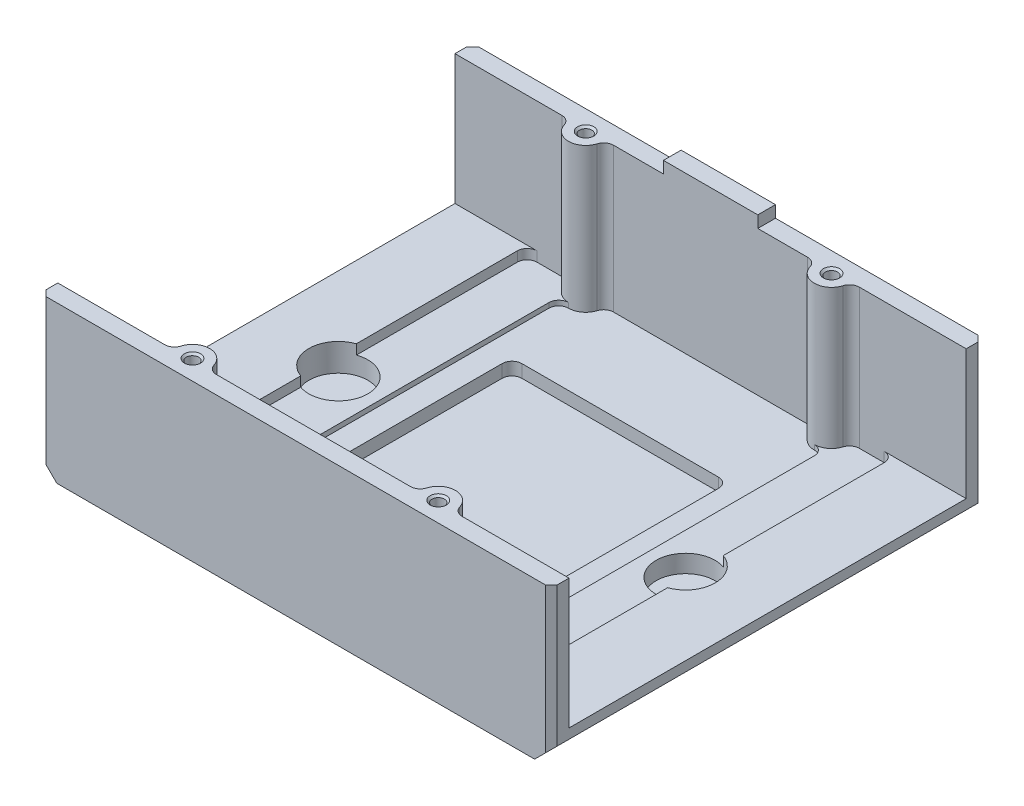
from build123d import *

# Parameters (mm, degrees)
SKETCH_1_W                     = 52
SKETCH_1_H                     = 44
EXTRUDE_1_DEPTH                = 16.5
SHELL_1_T                      = -1.8
CUT_EXTRUDE_1_DEPTH            = 68.500296296
CUT_EXTRUDE_1_DEPTH_BACK       = 68.500296296
SKETCH_3_W                     = 40.4
SKETCH_3_H                     = 14.7
SKETCH_4_W                     = 12.5
SKETCH_4_H                     = 40.4
EXTRUDE_2_DEPTH                = 1.5
CUT_EXTRUDE_2_DEPTH            = 1
EXTRUDE_3_REACH                = 66.438
SKETCH_6_R                     = 1.75
HOLE_WIZARD_M1_6_1_D           = 1.25
HOLE_WIZARD_M1_6_1_DEPTH       = 12
HOLE_WIZARD_M1_6_1_CSINK_D     = 1.65
HOLE_WIZARD_M1_6_1_CSINK_ANGLE = 90
HOLE_WIZARD_M1_6_1_TIP         = 0.375537887
SKETCH_11_W                    = 22
SKETCH_11_H                    = 22
CUT_EXTRUDE_3_DEPTH            = 1.3
CHAMFER_2_SIZE                 = 0.6
FILLET_1_R                     = 1
SKETCH_13_W                    = 9.6
SKETCH_13_H                    = 1.8
EXTRUDE_4_DEPTH                = 1.2
CHAMFER_3_SIZE                 = 2.3
SKETCH_14_R                    = 3
CUT_EXTRUDE_5_DEPTH            = 16


with BuildPart() as part:
    # 스케치1 → 보스-돌출1 (new body)
    with BuildSketch(Plane(origin=(0, 0, 0), x_dir=(1, 0, 0), z_dir=(0, 1, 0))):
        with Locations((20, 20)):
            Rectangle(SKETCH_1_W, SKETCH_1_H)
    extrude(amount=-EXTRUDE_1_DEPTH)

    # 쉘1
    shell_1_openings = [part.faces().sort_by_distance(p)[0] for p in [
        (20, 0, -20),
    ]]
    offset(amount=SHELL_1_T, openings=shell_1_openings, kind=Kind.INTERSECTION)

    # 스케치3 → 컷-돌출1 (cut, two sides: drawn at the far end of the back side and taken through both)
    with BuildSketch(Plane(origin=(-4.2, 0, 0), x_dir=(0, 0, -1), z_dir=(1, 0, 0)).offset(-CUT_EXTRUDE_1_DEPTH_BACK)):
        with Locations((20, -7.35)):
            Rectangle(SKETCH_3_W, SKETCH_3_H)
    extrude(amount=CUT_EXTRUDE_1_DEPTH + CUT_EXTRUDE_1_DEPTH_BACK, mode=Mode.SUBTRACT)

    # 스케치4 → 보스-돌출2 (add)
    with BuildSketch(Plane(origin=(0, -14.7, 0), x_dir=(1, 0, 0), z_dir=(0, 1, 0))):
        with Locations((39.75, 20)):
            Rectangle(SKETCH_4_W, SKETCH_4_H)
        with Locations((0.25, 20)):
            Rectangle(SKETCH_4_W, SKETCH_4_H)
    extrude(amount=EXTRUDE_2_DEPTH)

    # 스케치5 → 컷-돌출2 (cut)
    with BuildSketch(Plane(origin=(0, -13.2, 0), x_dir=(1, 0, 0), z_dir=(0, 1, 0))):
        Polygon((2.34, -0.2), (1.34, -0.2), (1.34, 40.2), (2.34, 40.2), (4.34, 40.2), (9.34, 40.2), (9.34, -0.2), (4.34, -0.2), align=None)
        Polygon((35.66, 40.2), (37.66, 40.2), (38.66, 40.2), (38.66, -0.2), (37.66, -0.2), (35.66, -0.2), (30.66, -0.2), (30.66, 40.2), align=None)
    extrude(amount=-CUT_EXTRUDE_2_DEPTH, mode=Mode.SUBTRACT)

    # 스케치6 → 보스-돌출3 (add, up to next)
    with BuildSketch(Plane(origin=(0, 0, 0), x_dir=(1, 0, 0), z_dir=(0, 1, 0)), mode=Mode.PRIVATE) as extrude_3_sk1:
        with Locations((7.5, 0)):
            Circle(SKETCH_6_R)
    extrude_3_tool1 = extrude(extrude_3_sk1.sketch, amount=-EXTRUDE_3_REACH, mode=Mode.PRIVATE) - part.part
    # 스케치6 → 보스-돌출3 (add, up to next)
    with BuildSketch(Plane(origin=(0, 0, 0), x_dir=(1, 0, 0), z_dir=(0, 1, 0)), mode=Mode.PRIVATE) as extrude_3_sk2:
        with Locations((7.5, 40)):
            Circle(SKETCH_6_R)
    extrude_3_tool2 = extrude(extrude_3_sk2.sketch, amount=-EXTRUDE_3_REACH, mode=Mode.PRIVATE) - part.part
    # 스케치6 → 보스-돌출3 (add, up to next)
    with BuildSketch(Plane(origin=(0, 0, 0), x_dir=(1, 0, 0), z_dir=(0, 1, 0)), mode=Mode.PRIVATE) as extrude_3_sk3:
        with Locations((32.5, 40)):
            Circle(SKETCH_6_R)
    extrude_3_tool3 = extrude(extrude_3_sk3.sketch, amount=-EXTRUDE_3_REACH, mode=Mode.PRIVATE) - part.part
    # 스케치6 → 보스-돌출3 (add, up to next)
    with BuildSketch(Plane(origin=(0, 0, 0), x_dir=(1, 0, 0), z_dir=(0, 1, 0)), mode=Mode.PRIVATE) as extrude_3_sk4:
        with Locations((32.5, 0)):
            Circle(SKETCH_6_R)
    extrude_3_tool4 = extrude(extrude_3_sk4.sketch, amount=-EXTRUDE_3_REACH, mode=Mode.PRIVATE) - part.part
    add(extrude_3_tool1.solids().sort_by_distance((7.5, 0, 0))[0])
    add(extrude_3_tool2.solids().sort_by_distance((7.5, 0, -40))[0])
    add(extrude_3_tool3.solids().sort_by_distance((32.5, 0, -40))[0])
    add(extrude_3_tool4.solids().sort_by_distance((32.5, 0, 0))[0])

    # M1.6 나사 구멍1
    with Locations(Plane(origin=(0, 0, 0), x_dir=(1, 0, 0), z_dir=(0, 1, 0))):
        with Locations((7.5, 0), (32.5, 0), (7.5, 40), (32.5, 40)):
            CounterSinkHole(HOLE_WIZARD_M1_6_1_D / 2, HOLE_WIZARD_M1_6_1_CSINK_D / 2, depth=HOLE_WIZARD_M1_6_1_DEPTH, counter_sink_angle=HOLE_WIZARD_M1_6_1_CSINK_ANGLE)
            with Locations((0, 0, -(HOLE_WIZARD_M1_6_1_DEPTH + HOLE_WIZARD_M1_6_1_TIP / 2))):  # 118° drill point
                Cone(0, HOLE_WIZARD_M1_6_1_D / 2, HOLE_WIZARD_M1_6_1_TIP, mode=Mode.SUBTRACT)

    # 스케치11 → 컷-돌출3 (cut)
    with BuildSketch(Plane(origin=(0, -14.7, 0), x_dir=(1, 0, 0), z_dir=(0, 1, 0))):
        with Locations((20, 20)):
            Rectangle(SKETCH_11_W, SKETCH_11_H)
    extrude(amount=-CUT_EXTRUDE_3_DEPTH, mode=Mode.SUBTRACT)

    # 모따기2
    chamfer_2_edges = [part.edges().sort_by_distance(p)[0] for p in [
        (20, -16.5, -42),
        (20, -16.5, 2),
        (-6, -8.25, -42),
        (46, -8.25, -42),
        (46, -8.25, 2),
        (-6, -8.25, 2),
    ]]
    chamfer(chamfer_2_edges, length=CHAMFER_2_SIZE)

    # 필렛1
    fillet_1_edges = [part.edges().sort_by_distance(p)[0] for p in [
        (38.66, -13.7, 0.2),
        (38.66, -13.7, -40.2),
        (9.238533865, -7.35, 0.2),
        (6.5, -14.45, -1.436140662),
        (5.761466135, -7.1, 0.2),
        (5.761466135, -7.1, -40.2),
        (6.5, -14.45, -38.563859338),
        (9.238533865, -7.35, -40.2),
        (30.761466135, -7.35, -40.2),
        (33.5, -14.45, -38.563859338),
        (34.238533865, -7.1, -40.2),
        (34.238533865, -7.1, 0.2),
        (33.5, -14.45, -1.436140662),
        (30.761466135, -7.35, 0.2),
        (9, -15.35, -9),
        (9, -15.35, -31),
        (31, -15.35, -31),
        (31, -15.35, -9),
        (1.34, -13.7, -40.2),
        (1.34, -13.7, 0.2),
    ]]
    fillet(fillet_1_edges, radius=FILLET_1_R)

    # 스케치13 → 보스-돌출4 (add)
    with BuildSketch(Plane(origin=(0, 0, 0), x_dir=(1, 0, 0), z_dir=(0, 1, 0))):
        with Locations((20, 41.1)):
            Rectangle(SKETCH_13_W, SKETCH_13_H)
    extrude(amount=EXTRUDE_4_DEPTH)

    # 모따기3
    # the kernel refuses this chamfer: 2.3 mm, written as the material it takes off along each edge
    with BuildSketch(Plane(origin=(46, -16.5, 7.314870872), x_dir=(0.027495876610586976, 0.9996219169112968, 0), z_dir=(0, 0, -1))) as chamfer_3_piece_1:
        Polygon((CHAMFER_3_SIZE * 0.999621916911, -CHAMFER_3_SIZE * 0.0274958766106), (-CHAMFER_3_SIZE * 0.0274958766106, -CHAMFER_3_SIZE * 0.999621916911), (0, 0), align=None)
    extrude(amount=54.629741745, mode=Mode.SUBTRACT)
    with BuildSketch(Plane(origin=(-6, -16.5, -47.314870872), x_dir=(0.9996219169112966, -0.027495876610586965, 0), z_dir=(0, 0, 1))) as chamfer_3_piece_2:
        Polygon((CHAMFER_3_SIZE * 0.999621916911, CHAMFER_3_SIZE * 0.0274958766106), (-CHAMFER_3_SIZE * 0.0274958766106, CHAMFER_3_SIZE * 0.999621916911), (0, 0), align=None)
    extrude(amount=54.629741745, mode=Mode.SUBTRACT)

    # 스케치14 → 컷-돌출5 (cut)
    with BuildSketch(Plane(origin=(0, 0, 0), x_dir=(1, 0, 0), z_dir=(0, 1, 0))):
        with Locations(Location((2.34, 20, 0), (0, 0, 270))):
            Circle(SKETCH_14_R)
        with Locations(Location((37.66, 20, 0), (0, 0, 270))):
            Circle(SKETCH_14_R)
    extrude(amount=-CUT_EXTRUDE_5_DEPTH, mode=Mode.SUBTRACT)


solid = part.part
